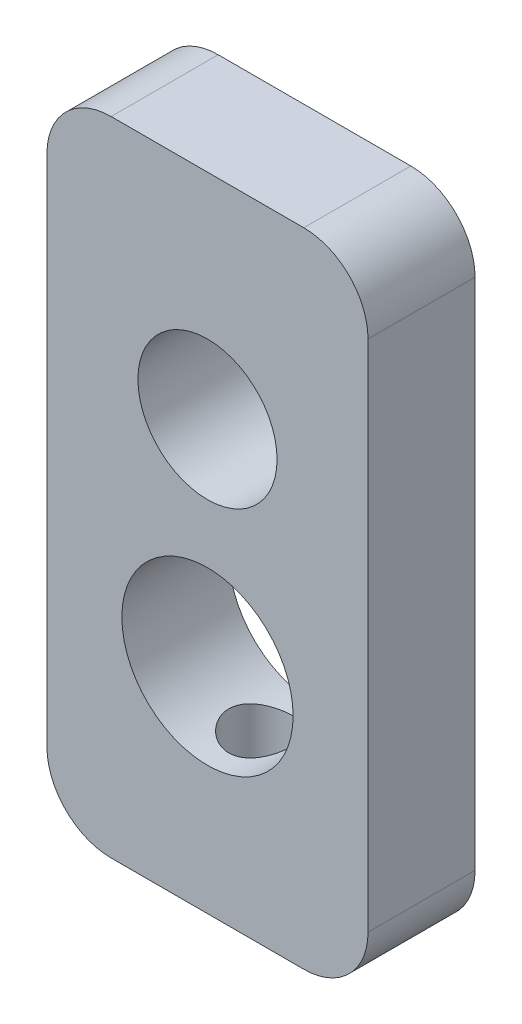
from build123d import *

# Parameters (mm, degrees)
SKETCH1_W           = 15
SKETCH1_H           = 30
SKETCH1_R           = 4
BOSS_EXTRUDE1_DEPTH = 5
SKETCH3_R           = 1.5
CUT_EXTRUDE1_DEPTH  = 30
SKETCH2_R           = 3.25
CUT_EXTRUDE2_DEPTH  = 10
FILLET1_R           = 3


with BuildPart() as part:
    # Sketch1 → Boss-Extrude1 (new body)
    with BuildSketch(Plane.XY):
        with Locations((0, 5)):
            Rectangle(SKETCH1_W, SKETCH1_H)
        Circle(SKETCH1_R, mode=Mode.SUBTRACT)
    extrude(amount=BOSS_EXTRUDE1_DEPTH)

    # Sketch3 → Cut-Extrude1 (cut)
    with BuildSketch(Plane(origin=(0, 0, 0), x_dir=(0, 0, -1), z_dir=(0, 1, 0))):
        with Locations((-2.5, 0)):
            Circle(SKETCH3_R)
    extrude(amount=-CUT_EXTRUDE1_DEPTH, mode=Mode.SUBTRACT)

    # Sketch2 → Cut-Extrude2 (cut)
    with BuildSketch(Plane(origin=(0, -24.379216841, 5), x_dir=(1, 0, 0), z_dir=(0, 0, -1))):
        with Locations((0, -34.379216841)):
            Circle(SKETCH2_R)
    extrude(amount=CUT_EXTRUDE2_DEPTH, mode=Mode.SUBTRACT)

    # Fillet1
    fillet1_edges = [part.edges().sort_by_distance(p)[0] for p in [
        (7.5, -10, 2.5),
        (-7.5, -10, 2.5),
        (-7.5, 20, 2.5),
        (7.5, 20, 2.5),
    ]]
    fillet(fillet1_edges, radius=FILLET1_R)


solid = part.part
